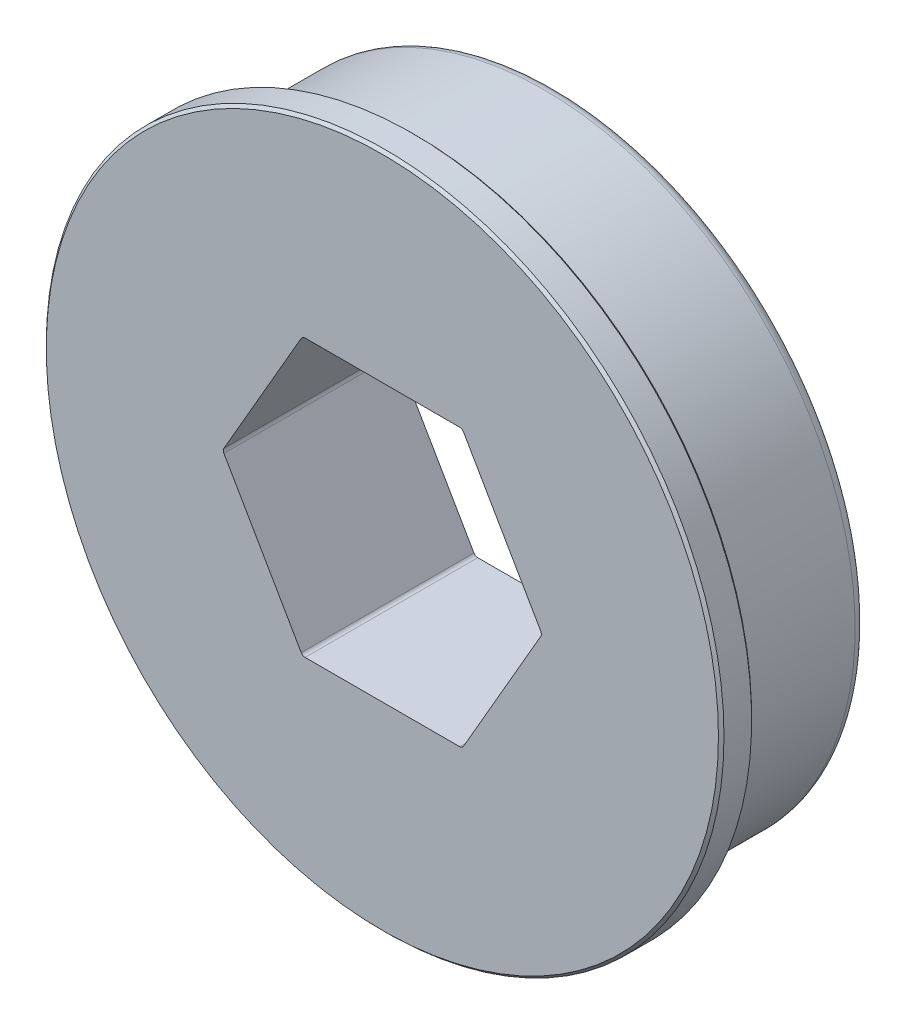
from build123d import *

# Parameters (mm, degrees)
CUT_EXTRUDE1_DEPTH = 24.386199605
CHAMFER1_SIZE      = 0.127
CHAMFER2_SIZE      = 0.127
FILLET1_R          = 0.508
FILLET2_R          = 0.2032


with BuildPart() as part:
    # Sketch1 → Revolve1 (revolve)
    with BuildSketch(Plane.XZ):
        Polygon((15.5575, 7.92734), (0, 7.92734), (0, 0), (14.2875, 0), (14.2875, 5.89534), (13.97, 5.89534), (13.97, 6.40334), (15.5575, 6.40334), align=None)
    revolve(axis=Axis((0, 0, 7.92734), (0, 0, -1)))

    # Sketch2 → Cut-Extrude1 (cut, through all)
    with BuildSketch(Plane(origin=(0, 0, 0), x_dir=(-1, 0, 0), z_dir=(0, 0, -1))):
        Polygon((3.666174209, 6.35), (-3.666174209, 6.35), (-7.332348419, 0), (-3.666174209, -6.35), (3.666174209, -6.35), (7.332348419, 0), align=None)
    extrude(amount=-CUT_EXTRUDE1_DEPTH, mode=Mode.SUBTRACT)

    # Chamfer1
    chamfer1_edges = [part.edges().sort_by_distance(p)[0] for p in [
        (-15.5575, 0, 6.40334),
    ]]
    chamfer(chamfer1_edges, length=CHAMFER1_SIZE)

    # Chamfer2
    chamfer2_edges = [part.edges().sort_by_distance(p)[0] for p in [
        (-15.5575, 0, 7.92734),
    ]]
    chamfer(chamfer2_edges, length=CHAMFER2_SIZE)

    # Fillet1
    fillet1_edges = [part.edges().sort_by_distance(p)[0] for p in [
        (-14.2875, 0, 0),
    ]]
    fillet(fillet1_edges, radius=FILLET1_R)

    # Fillet2
    fillet2_edges = [part.edges().sort_by_distance(p)[0] for p in [
        (3.666174209, 6.35, 3.96367),
        (7.332348419, 0, 3.96367),
        (3.666174209, -6.35, 3.96367),
        (-3.666174209, -6.35, 3.96367),
        (-7.332348419, 0, 3.96367),
        (-3.666174209, 6.35, 3.96367),
    ]]
    fillet(fillet2_edges, radius=FILLET2_R)


solid = part.part
